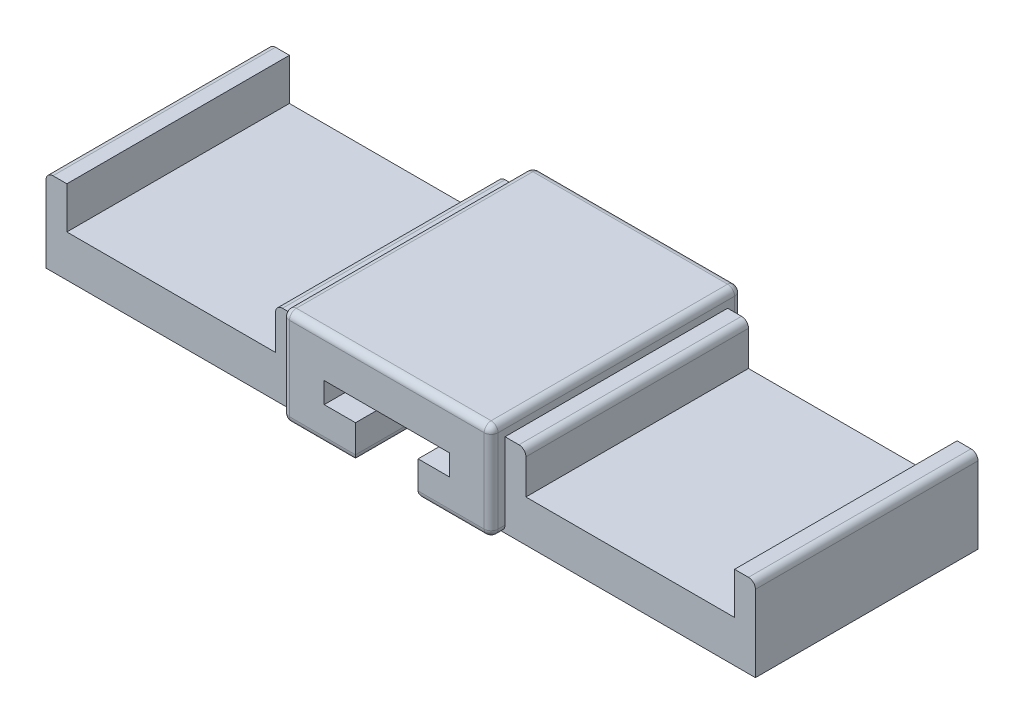
from build123d import *

# Parameters (mm, degrees)
SKETCH1_W           = 15
SKETCH1_H           = 18
BOSS_EXTRUDE1_DEPTH = 7
CUT_EXTRUDE1_DEPTH  = 16.2
SKETCH9_W           = 16
SKETCH9_H           = 6
BOSS_EXTRUDE2_DEPTH = 18
SKETCH13_W          = 16
SKETCH13_H          = 6
BOSS_EXTRUDE3_DEPTH = 18
SKETCH14_W          = 15
SKETCH14_H          = 3
CUT_EXTRUDE5_DEPTH  = 32.55
FILLET1_R           = 0.5


with BuildPart() as part:
    # Sketch1 → Boss-Extrude1 (new body)
    with BuildSketch(Plane(origin=(0, 0, 0), x_dir=(1, 0, 0), z_dir=(0, 1, 0))):
        Rectangle(SKETCH1_W, SKETCH1_H)
    extrude(amount=BOSS_EXTRUDE1_DEPTH)

    # Sketch2 → Cut-Extrude1 (cut)
    with BuildSketch(Plane.XY.offset(9)):
        Polygon((-2.25, 2.5), (-2.25, 0), (2.25, 0), (2.25, 2.5), (4.5, 2.5), (4.5, 4), (-4.5, 4), (-4.5, 2.5), align=None)
    extrude(amount=-CUT_EXTRUDE1_DEPTH, mode=Mode.SUBTRACT)

    # Sketch9 → Boss-Extrude2 (add)
    with BuildSketch(Plane.ZY.offset(7.5)):
        with Locations((0, 3)):
            Rectangle(SKETCH9_W, SKETCH9_H)
    extrude(amount=BOSS_EXTRUDE2_DEPTH)

    # Sketch13 → Boss-Extrude3 (add)
    with BuildSketch(Plane(origin=(7.5, 0, 0), x_dir=(0, 0, -1), z_dir=(1, 0, 0))):
        with Locations((0, 3)):
            Rectangle(SKETCH13_W, SKETCH13_H)
    extrude(amount=BOSS_EXTRUDE3_DEPTH)

    # Sketch14 → Cut-Extrude5 (cut)
    with BuildSketch(Plane.XY.offset(9)):
        with Locations((16.5, 4.5)):
            Rectangle(SKETCH14_W, SKETCH14_H)
        with Locations((-16.5, 4.5)):
            Rectangle(SKETCH14_W, SKETCH14_H)
    extrude(amount=-CUT_EXTRUDE5_DEPTH, mode=Mode.SUBTRACT)

    # Fillet1
    fillet1_edges = [part.edges().sort_by_distance(p)[0] for p in [
        (0, 0, -9),
        (7.5, 0, -8.5),
        (-7.5, 0, -8.5),
        (-7.5, 0, 8.5),
        (7.5, 0, 8.5),
        (7.5, 7, 0),
        (25.5, 6, 0),
        (-25.5, 6, 0),
        (-7.5, 7, 0),
        (-7.5, 3.5, 9),
        (7.5, 3.5, 9),
        (4.875, 0, 9),
        (2.25, 0, 0.9),
        (-2.25, 0, 0.9),
        (-4.875, 0, 9),
        (0, 7, 9),
        (0, 7, -9),
        (7.5, 3.5, -9),
        (-7.5, 3.5, -9),
        (-9, 6, 0),
        (9, 6, 0),
    ]]
    fillet(fillet1_edges, radius=FILLET1_R)


solid = part.part
